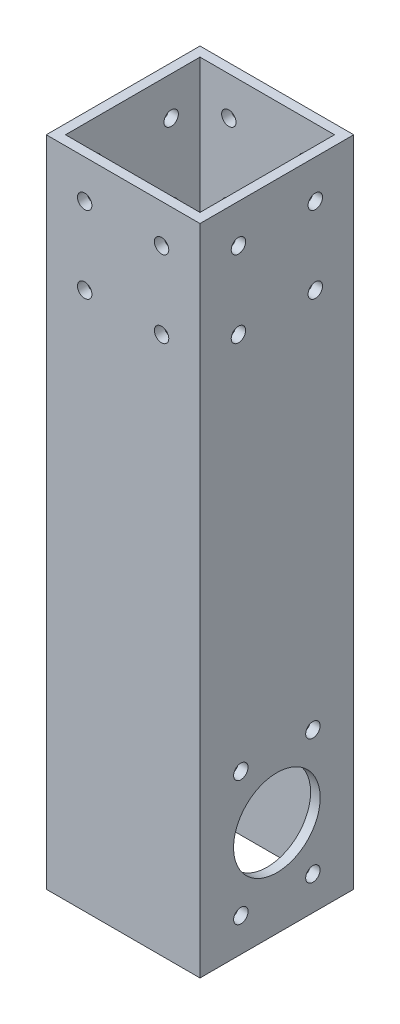
from build123d import *

# Parameters (mm, degrees)
SKETCH1_W           = 50.8
SKETCH1_H           = 50.8
BOSS_EXTRUDE1_DEPTH = 215.9
SHELL1_T            = -3.175
SKETCH2_R           = 14.3129
CUT_EXTRUDE1_DEPTH  = 224.245627057
SKETCH3_R           = 2.38125
CUT_EXTRUDE2_DEPTH  = 224.245627057
SKETCH4_R           = 2.38125
CUT_EXTRUDE3_DEPTH  = 224.245627057
SKETCH5_R           = 2.38125
CUT_EXTRUDE4_DEPTH  = 224.245627057


with BuildPart() as part:
    # Sketch1 → Boss-Extrude1 (new body)
    with BuildSketch(Plane(origin=(0, 0, 0), x_dir=(1, 0, 0), z_dir=(0, 1, 0))):
        Rectangle(SKETCH1_W, SKETCH1_H)
    extrude(amount=BOSS_EXTRUDE1_DEPTH)

    # Shell1
    shell1_openings = [part.faces().sort_by_distance(p)[0] for p in [
        (0, 0, 0),
        (0, 215.9, 0),
    ]]
    offset(amount=SHELL1_T, openings=shell1_openings, kind=Kind.INTERSECTION)

    # Sketch2 → Cut-Extrude1 (cut, through all)
    with BuildSketch(Plane(origin=(25.4, 0, 0), x_dir=(0, 0, -1), z_dir=(1, 0, 0))):
        with Locations((0, 31.75)):
            Circle(SKETCH2_R)
    extrude(amount=-CUT_EXTRUDE1_DEPTH, mode=Mode.SUBTRACT)

    # Sketch3 → Cut-Extrude2 (cut, through all)
    with BuildSketch(Plane(origin=(25.4, 0, 0), x_dir=(0, 0, -1), z_dir=(1, 0, 0))):
        with Locations((-11.90625, 52.372229928)):
            Circle(SKETCH3_R)
        with Locations((11.90625, 52.372229928)):
            Circle(SKETCH3_R)
        with Locations((11.90625, 11.127770072)):
            Circle(SKETCH3_R)
        with Locations((-11.90625, 11.127770072)):
            Circle(SKETCH3_R)
    extrude(amount=-CUT_EXTRUDE2_DEPTH, mode=Mode.SUBTRACT)

    # Sketch4 → Cut-Extrude3 (cut, through all)
    with BuildSketch(Plane(origin=(25.4, 0, 0), x_dir=(0, 0, -1), z_dir=(1, 0, 0))):
        with Locations((-12.7, 203.2)):
            Circle(SKETCH4_R)
        with Locations((12.7, 203.2)):
            Circle(SKETCH4_R)
        with Locations((12.7, 177.8)):
            Circle(SKETCH4_R)
        with Locations((-12.7, 177.8)):
            Circle(SKETCH4_R)
    extrude(amount=-CUT_EXTRUDE3_DEPTH, mode=Mode.SUBTRACT)

    # Sketch5 → Cut-Extrude4 (cut, through all)
    with BuildSketch(Plane.XY.offset(25.4)):
        with Locations((-12.7, 203.2)):
            Circle(SKETCH5_R)
        with Locations((12.7, 203.2)):
            Circle(SKETCH5_R)
        with Locations((12.7, 177.8)):
            Circle(SKETCH5_R)
        with Locations((-12.7, 177.8)):
            Circle(SKETCH5_R)
    extrude(amount=-CUT_EXTRUDE4_DEPTH, mode=Mode.SUBTRACT)


solid = part.part
